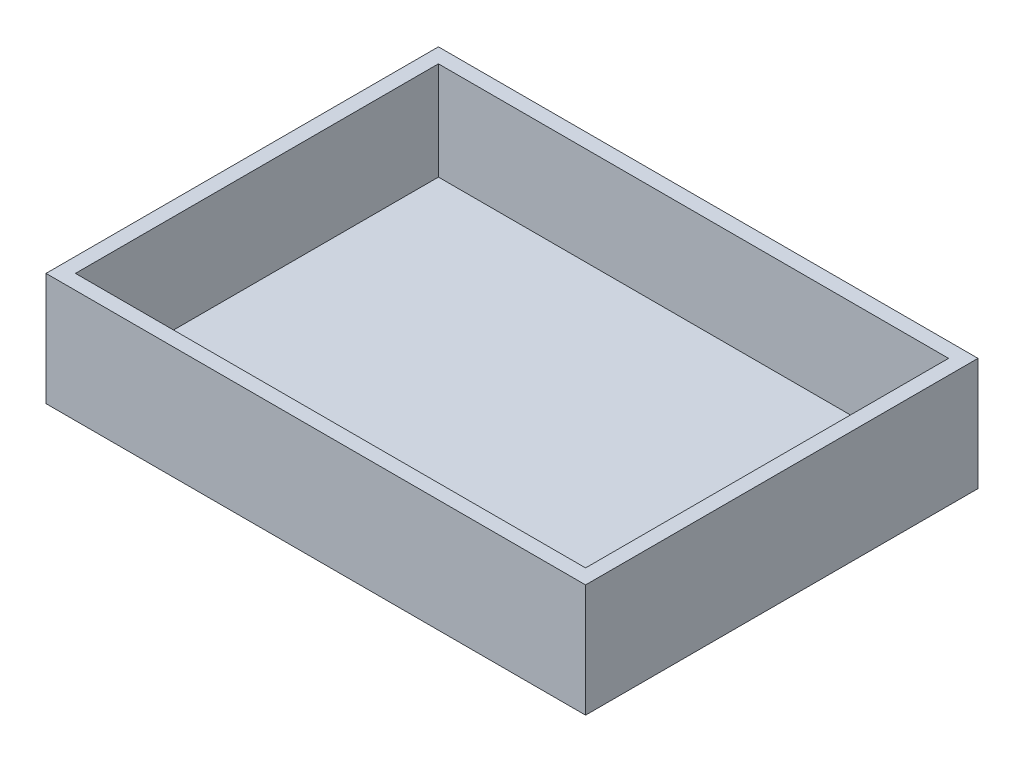
from build123d import *

# Parameters (mm, degrees)
SKETCH_1_W      = 55
SKETCH_1_H      = 40
EXTRUDE_1_DEPTH = 11.5
SHELL_1_T       = -1.5


with BuildPart() as part:
    # 草图1 → 凸台-拉伸1 (new body)
    with BuildSketch(Plane(origin=(0, 0, 0), x_dir=(1, 0, 0), z_dir=(0, 1, 0))):
        Rectangle(SKETCH_1_W, SKETCH_1_H)
    extrude(amount=EXTRUDE_1_DEPTH)

    # 抽壳1
    shell_1_openings = [part.faces().sort_by_distance(p)[0] for p in [
        (0, 11.5, 0),
    ]]
    offset(amount=SHELL_1_T, openings=shell_1_openings, kind=Kind.INTERSECTION)


solid = part.part
